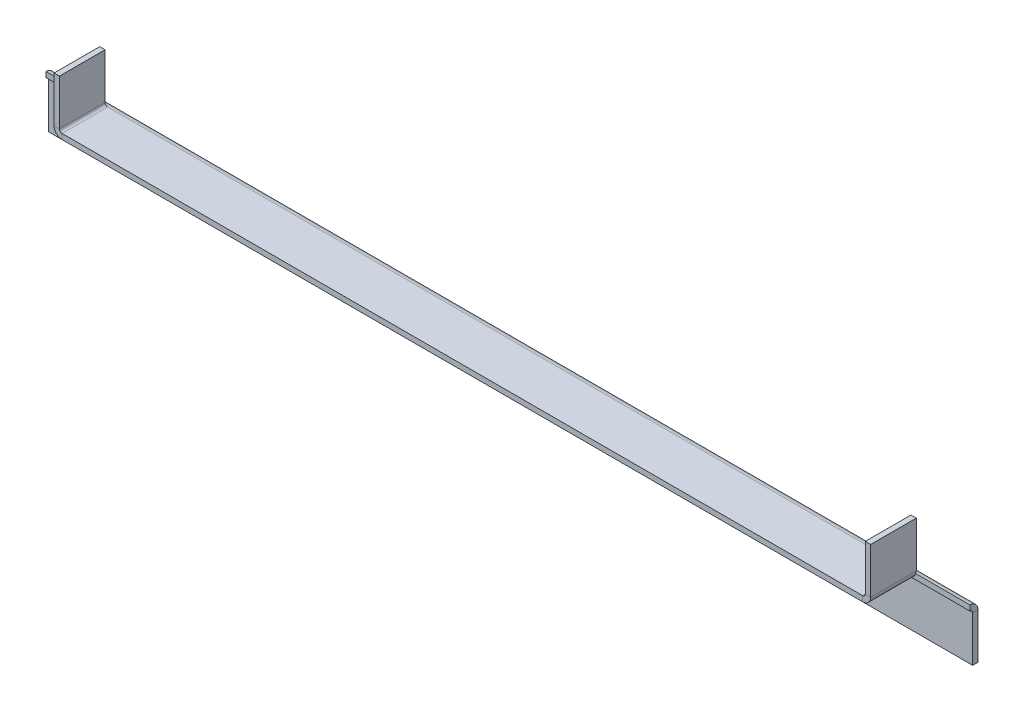
from build123d import *

# Parameters (mm, degrees)
SKETCH_1_W                       = 2
SKETCH_1_H                       = 20
EXTRUDE_1_DEPTH                  = 344.2
SM_EDGE_FLANGE_1_STRIP_W         = 10
SM_EDGE_FLANGE_1_STRIP_H         = 2
SM_EDGE_FLANGE_1_STRIP_CUT_DEPTH = 344.2
SM_EDGE_FLANGE_1_DEPTH           = 344.2
SM_EDGE_FLANGE_2_STRIP_W         = 30
SM_EDGE_FLANGE_2_STRIP_H         = 2
SM_EDGE_FLANGE_2_STRIP_CUT_DEPTH = 17
SM_EDGE_FLANGE_2_DEPTH           = 17
SM_EDGE_FLANGE_3_STRIP_W         = 30
SM_EDGE_FLANGE_3_STRIP_H         = 2
SM_EDGE_FLANGE_3_STRIP_CUT_DEPTH = 17
SM_EDGE_FLANGE_3_DEPTH           = 17


# Sheet-metal steps are written as plain solids
with BuildPart() as part:
    # Sketch 1 → Бобышка-Вытянуть1 (new body)
    with BuildSketch(Plane(origin=(0, 0, 0), x_dir=(0, 0, -1), z_dir=(1, 0, 0))):
        with Locations((1, 10)):
            Rectangle(SKETCH_1_W, SKETCH_1_H)
    extrude(amount=EXTRUDE_1_DEPTH)

    # Ребро-кромка1 strip (across the edge) → Ребро-кромка1 strip cut (cut)
    with BuildSketch(Plane(origin=(344.2, 20, 0), x_dir=(0, -1, 0), z_dir=(-1, 0, 0))):
        with Locations((-2, -1)):
            Rectangle(SM_EDGE_FLANGE_1_STRIP_W, SM_EDGE_FLANGE_1_STRIP_H)
    extrude(amount=SM_EDGE_FLANGE_1_STRIP_CUT_DEPTH, mode=Mode.SUBTRACT)

    # Ребро-кромка1 section (across the edge) → Ребро-кромка1 (add)
    with BuildSketch(Plane(origin=(344.2, 20, 0), x_dir=(0, -1, 0), z_dir=(-1, 0, 0))):
        with BuildLine():
            Line((0, 1), (0, 18))
            Line((0, 18), (2, 18))
            Line((2, 18), (2, 1))
            ThreePointArc((2, 1), (2.292893219, 0.292893219), (3, 0))
            Line((3, 0), (3, -2))
            ThreePointArc((3, -2), (0.878679656, -1.121320344), (0, 1))
        make_face()
    extrude(amount=SM_EDGE_FLANGE_1_DEPTH)

    # Ребро-кромка2 strip (across the edge) → Ребро-кромка2 strip cut (cut)
    with BuildSketch(Plane(origin=(20, 20, 1), x_dir=(1, 0, 0), z_dir=(0, 0, 1))):
        with Locations((-12, -1)):
            Rectangle(SM_EDGE_FLANGE_2_STRIP_W, SM_EDGE_FLANGE_2_STRIP_H)
    extrude(amount=SM_EDGE_FLANGE_2_STRIP_CUT_DEPTH, mode=Mode.SUBTRACT)

    # Ребро-кромка2 section (across the edge) → Ребро-кромка2 (add)
    with BuildSketch(Plane(origin=(20, 20, 1), x_dir=(1, 0, 0), z_dir=(0, 0, 1))):
        with BuildLine():
            Line((0, 1), (0, 18))
            Line((0, 18), (2, 18))
            Line((2, 18), (2, 1))
            ThreePointArc((2, 1), (2.292893219, 0.292893219), (3, 0))
            Line((3, 0), (3, -2))
            ThreePointArc((3, -2), (0.878679656, -1.121320344), (0, 1))
        make_face()
    extrude(amount=SM_EDGE_FLANGE_2_DEPTH)

    # Ребро-кромка3 strip (across the edge) → Ребро-кромка3 strip cut (cut)
    with BuildSketch(Plane(origin=(324.2, 20, 18), x_dir=(-1, 0, 0), z_dir=(0, 0, -1))):
        with Locations((-12, -1)):
            Rectangle(SM_EDGE_FLANGE_3_STRIP_W, SM_EDGE_FLANGE_3_STRIP_H)
    extrude(amount=SM_EDGE_FLANGE_3_STRIP_CUT_DEPTH, mode=Mode.SUBTRACT)

    # Ребро-кромка3 section (across the edge) → Ребро-кромка3 (add)
    with BuildSketch(Plane(origin=(324.2, 20, 18), x_dir=(-1, 0, 0), z_dir=(0, 0, -1))):
        with BuildLine():
            Line((0, 1), (0, 18))
            Line((0, 18), (2, 18))
            Line((2, 18), (2, 1))
            ThreePointArc((2, 1), (2.292893219, 0.292893219), (3, 0))
            Line((3, 0), (3, -2))
            ThreePointArc((3, -2), (0.878679656, -1.121320344), (0, 1))
        make_face()
    extrude(amount=SM_EDGE_FLANGE_3_DEPTH)


solid = part.part
